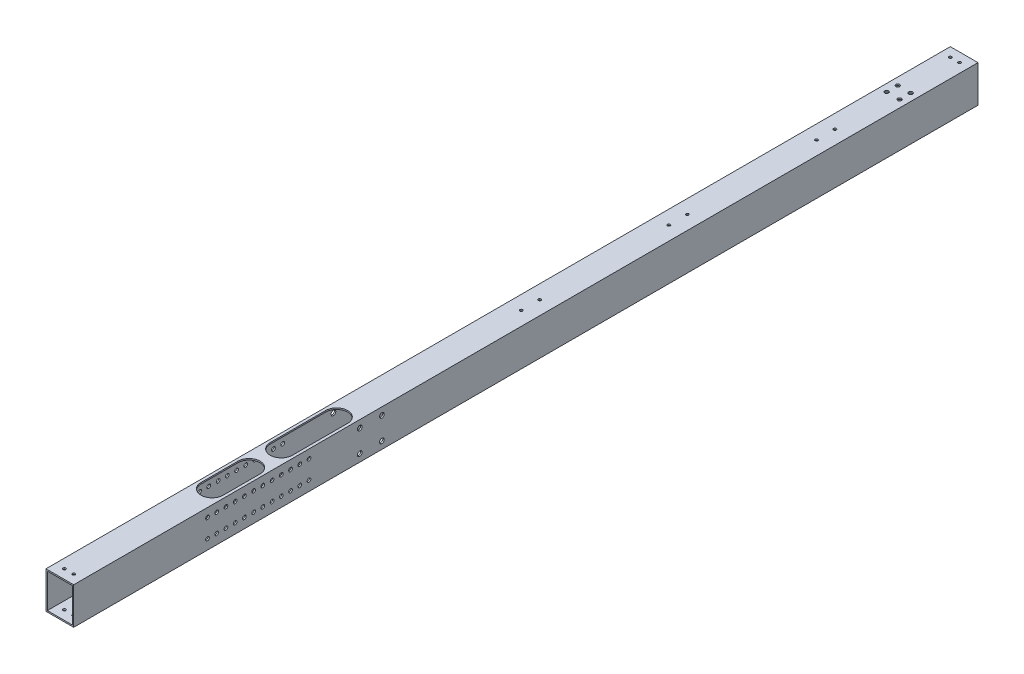
from build123d import *

# Parameters (mm, degrees)
SKETCH_1_W             = 30
SKETCH_1_H             = 40
SKETCH_1_W_2           = 27
SKETCH_1_H_2           = 37
EXTRUDE_1_DEPTH        = 980
SKETCH_3_R             = 1.5
CUT_EXTRUDE_2_DEPTH    = 981.930680527
SKETCH_4_R             = 3.25
CUT_EXTRUDE_3_DEPTH    = 21
SKETCH_5_R             = 1.5
CUT_EXTRUDE_4_DEPTH    = 981.930680527
CUT_EXTRUDE_6_DEPTH    = 10
SKETCH_9_R             = 1.6
CUT_EXTRUDE_7_DEPTH    = 10
PATTERN_LINEAR_1_COUNT = 6
PATTERN_LINEAR_1_PITCH = 13
SKETCH_10_R            = 2.55
CUT_EXTRUDE_8_DEPTH    = 51
SKETCH_11_R            = 2
CUT_EXTRUDE_9_DEPTH    = 51
SKETCH_12_R            = 2.1
CUT_EXTRUDE_10_DEPTH   = 10
CUT_EXTRUDE_11_DEPTH   = 10
CUT_EXTRUDE_12_DEPTH   = 10
SKETCH_15_R            = 1.6
CUT_EXTRUDE_13_DEPTH   = 95
CUT_EXTRUDE_14_DEPTH   = 5


with BuildPart() as part:
    # 草图1 → 凸台-拉伸1 (new body)
    with BuildSketch(Plane.XY):
        Rectangle(SKETCH_1_W, SKETCH_1_H)
        Rectangle(SKETCH_1_W_2, SKETCH_1_H_2, mode=Mode.SUBTRACT)
    extrude(amount=EXTRUDE_1_DEPTH)

    # 草图3 → 切除-拉伸2 (cut, through all)
    with BuildSketch(Plane(origin=(0, 20, 0), x_dir=(-1, 0, 0), z_dir=(0, -1, 0))):
        with Locations((5, -10)):
            Circle(SKETCH_3_R)
        with Locations((-5, -10)):
            Circle(SKETCH_3_R)
        with Locations((-5, -970)):
            Circle(SKETCH_3_R)
        with Locations((5, -970)):
            Circle(SKETCH_3_R)
    extrude(amount=CUT_EXTRUDE_2_DEPTH, mode=Mode.SUBTRACT)

    # 草图4 → 切除-拉伸3 (cut)
    with BuildSketch(Plane(origin=(0, 20, 0), x_dir=(-1, 0, 0), z_dir=(0, -1, 0))):
        with Locations((-8.27006126, -772.5)):
            Circle(SKETCH_4_R)
        with Locations((6.72993874, -772.5)):
            Circle(SKETCH_4_R)
        with Locations((6.72993874, -787.5)):
            Circle(SKETCH_4_R)
        with Locations((-8.27006126, -787.5)):
            Circle(SKETCH_4_R)
    extrude(amount=CUT_EXTRUDE_3_DEPTH, mode=Mode.SUBTRACT)

    # 草图5 → 切除-拉伸4 (cut, through all)
    with BuildSketch(Plane(origin=(0, 20, 0), x_dir=(-1, 0, 0), z_dir=(0, -1, 0))):
        with Locations((0, -140)):
            Circle(SKETCH_5_R)
        with Locations((0, -160)):
            Circle(SKETCH_5_R)
        with Locations((0, -300)):
            Circle(SKETCH_5_R)
        with Locations((0, -320)):
            Circle(SKETCH_5_R)
        with Locations((0, -480)):
            Circle(SKETCH_5_R)
        with Locations((0, -460)):
            Circle(SKETCH_5_R)
    extrude(amount=CUT_EXTRUDE_4_DEPTH, mode=Mode.SUBTRACT)

    # 草图8 → 切除-拉伸6 (cut)
    with BuildSketch(Plane.XZ.offset(20)):
        with BuildLine():
            Line((7.5, 160), (7.5, 140))
            ThreePointArc((7.5, 140), (0, 132.5), (-7.5, 140))
            Line((-7.5, 140), (-7.5, 160))
            ThreePointArc((-7.5, 160), (0, 167.5), (7.5, 160))
        make_face()
        with BuildLine():
            Line((7.5, 480), (7.5, 460))
            ThreePointArc((7.5, 460), (0, 452.5), (-7.5, 460))
            Line((-7.5, 460), (-7.5, 480))
            ThreePointArc((-7.5, 480), (0, 487.5), (7.5, 480))
        make_face()
        with BuildLine():
            Line((7.5, 320), (7.5, 300))
            ThreePointArc((7.5, 300), (0, 292.5), (-7.5, 300))
            Line((-7.5, 300), (-7.5, 320))
            ThreePointArc((-7.5, 320), (0, 327.5), (7.5, 320))
        make_face()
    extrude(amount=-CUT_EXTRUDE_6_DEPTH, mode=Mode.SUBTRACT)

    # 草图9 → 切除-拉伸7 (cut)
    with BuildSketch(Plane.XZ.offset(20)):
        with Locations((10, 787.5)):
            Circle(SKETCH_9_R)
        with Locations((10, 774.5)):
            Circle(SKETCH_9_R)
        with Locations((-10, 774.5)):
            Circle(SKETCH_9_R)
        with Locations((-10, 787.5)):
            Circle(SKETCH_9_R)
    cut_extrude_7 = extrude(amount=-CUT_EXTRUDE_7_DEPTH, mode=Mode.SUBTRACT)

    # 阵列(线性)1: 切除-拉伸7 ×6
    with Locations(*[(0, 0, -i * PATTERN_LINEAR_1_PITCH) for i in range(1, PATTERN_LINEAR_1_COUNT)]):
        add(cut_extrude_7, mode=Mode.SUBTRACT)

    # 草图10 → 切除-拉伸8 (cut)
    with BuildSketch(Plane.ZY.offset(15)):
        with Locations((646, 12)):
            Circle(SKETCH_10_R)
        with Locations((670, 12)):
            Circle(SKETCH_10_R)
        with Locations((646, -12)):
            Circle(SKETCH_10_R)
        with Locations((670, -12)):
            Circle(SKETCH_10_R)
    extrude(amount=-CUT_EXTRUDE_8_DEPTH, mode=Mode.SUBTRACT)

    # 草图11 → 切除-拉伸9 (cut)
    with BuildSketch(Plane.ZY.offset(15)):
        with Locations((725, 10.625214933)):
            Circle(SKETCH_11_R)
        with Locations((725, -9.374785067)):
            Circle(SKETCH_11_R)
        with Locations((735, 10.625214933)):
            Circle(SKETCH_11_R)
        with Locations((735, -9.374785067)):
            Circle(SKETCH_11_R)
        with Locations((745, 10.625214933)):
            Circle(SKETCH_11_R)
        with Locations((745, -9.374785067)):
            Circle(SKETCH_11_R)
        with Locations((755, 10.625214933)):
            Circle(SKETCH_11_R)
        with Locations((755, -9.374785067)):
            Circle(SKETCH_11_R)
        with Locations((765, 10.625214933)):
            Circle(SKETCH_11_R)
        with Locations((765, -9.374785067)):
            Circle(SKETCH_11_R)
        with Locations((775, 10.625214933)):
            Circle(SKETCH_11_R)
        with Locations((775, -9.374785067)):
            Circle(SKETCH_11_R)
        with Locations((785, 10.625214933)):
            Circle(SKETCH_11_R)
        with Locations((785, -9.374785067)):
            Circle(SKETCH_11_R)
        with Locations((795, 10.625214933)):
            Circle(SKETCH_11_R)
        with Locations((795, -9.374785067)):
            Circle(SKETCH_11_R)
        with Locations((805, 10.625214933)):
            Circle(SKETCH_11_R)
        with Locations((805, -9.374785067)):
            Circle(SKETCH_11_R)
        with Locations((815, 10.625214933)):
            Circle(SKETCH_11_R)
        with Locations((815, -9.374785067)):
            Circle(SKETCH_11_R)
        with Locations((825, 10.625214933)):
            Circle(SKETCH_11_R)
        with Locations((825, -9.374785067)):
            Circle(SKETCH_11_R)
        with Locations((835, 10.625214933)):
            Circle(SKETCH_11_R)
        with Locations((835, -9.374785067)):
            Circle(SKETCH_11_R)
    extrude(amount=-CUT_EXTRUDE_9_DEPTH, mode=Mode.SUBTRACT)

    # 草图12 → 切除-拉伸10 (cut)
    with BuildSketch(Plane(origin=(0, 20, 0), x_dir=(1, 0, 0), z_dir=(0, 1, 0))):
        with Locations((-7, -65)):
            Circle(SKETCH_12_R)
        with Locations((-7, -77)):
            Circle(SKETCH_12_R)
        with Locations((7, -77)):
            Circle(SKETCH_12_R)
        with Locations((7, -65)):
            Circle(SKETCH_12_R)
    extrude(amount=-CUT_EXTRUDE_10_DEPTH, mode=Mode.SUBTRACT)

    # 草图13 → 切除-拉伸11 (cut)
    with BuildSketch(Plane.XZ.offset(20)):
        with BuildLine():
            Line((-8.20885401, 70.140843723), (-8.20885401, 99.712723414))
            ThreePointArc((-8.20885401, 99.712723414), (0, 107.921577424), (8.20885401, 99.712723414))
            Line((8.20885401, 99.712723414), (8.20885401, 70.140843723))
            ThreePointArc((8.20885401, 70.140843723), (0, 61.931989713), (-8.20885401, 70.140843723))
        make_face()
    extrude(amount=-CUT_EXTRUDE_11_DEPTH, mode=Mode.SUBTRACT)

    # 草图14 → 切除-拉伸12 (cut)
    with BuildSketch(Plane(origin=(0, 20, 0), x_dir=(1, 0, 0), z_dir=(0, 1, 0))):
        with BuildLine():
            Line((12, -775), (12, -815))
            ThreePointArc((12, -815), (0, -827), (-12, -815))
            Line((-12, -815), (-12, -775))
            ThreePointArc((-12, -775), (0, -763), (12, -775))
        make_face()
    extrude(amount=-CUT_EXTRUDE_12_DEPTH, mode=Mode.SUBTRACT)

    # 草图15 → 切除-拉伸13 (cut)
    with BuildSketch(Plane.XZ.offset(20)):
        with Locations((-7.5, 700)):
            Circle(SKETCH_15_R)
        with Locations((7.5, 700)):
            Circle(SKETCH_15_R)
        with Locations((-7.5, 680)):
            Circle(SKETCH_15_R)
        with Locations((7.5, 680)):
            Circle(SKETCH_15_R)
    extrude(amount=-CUT_EXTRUDE_13_DEPTH, mode=Mode.SUBTRACT)

    # 草图16 → 切除-拉伸14 (cut)
    with BuildSketch(Plane(origin=(0, 20, 0), x_dir=(1, 0, 0), z_dir=(0, 1, 0))):
        with BuildLine():
            Line((12, -680), (12, -740))
            ThreePointArc((12, -740), (0, -752), (-12, -740))
            Line((-12, -740), (-12, -680))
            ThreePointArc((-12, -680), (0, -668), (12, -680))
        make_face()
    extrude(amount=-CUT_EXTRUDE_14_DEPTH, mode=Mode.SUBTRACT)


solid = part.part
